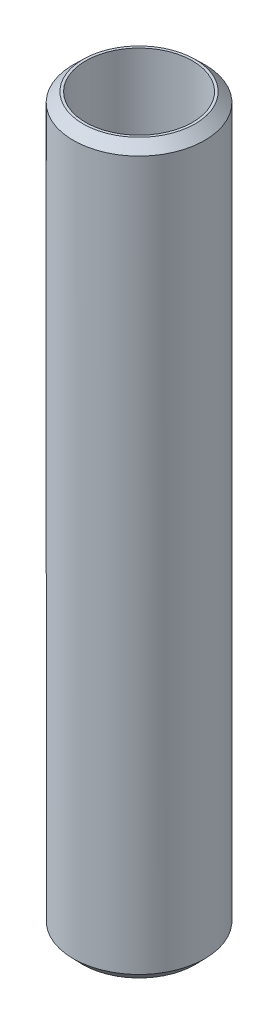
from build123d import *
from OCP.BRepFilletAPI import BRepFilletAPI_MakeChamfer

# Parameters (mm, degrees)
SKETCH1_R           = 32.5
BOSS_EXTRUDE1_DEPTH = 360.140918461
SKETCH2_R           = 26.420446691
CUT_EXTRUDE1_DEPTH  = 364.06195222
CHAMFER1_SIZE       = 4.666880794
CHAMFER1_SIZE2      = 4.810373558


with BuildPart() as part:
    # Sketch1 → Boss-Extrude1 (new body)
    with BuildSketch(Plane(origin=(0, 0, 0), x_dir=(1, 0, 0), z_dir=(0, 1, 0))):
        Circle(SKETCH1_R)
    extrude(amount=BOSS_EXTRUDE1_DEPTH)

    # Sketch2 → Cut-Extrude1 (cut, through all)
    with BuildSketch(Plane(origin=(0, 0, 0), x_dir=(1, 0, 0), z_dir=(0, 1, 0))):
        Circle(SKETCH2_R)
    extrude(amount=CUT_EXTRUDE1_DEPTH, mode=Mode.SUBTRACT)

    # Chamfer1: one chamfer whose edges measure the first distance from different faces: ONE call of the kernel's chamfer builder (chamfer() names one face for all edges)
    chamfer1_edges_1 = [part.edges().sort_by_distance(p)[0] for p in [
        (-32.5, 360.140918461, 0),
    ]]
    chamfer1_side_1 = [part.faces().sort_by_distance(p)[0] for p in [
        (-32.5, 180.070459231, 0),
    ]]
    chamfer1_edges_2 = [part.edges().sort_by_distance(p)[0] for p in [
        (-32.5, 0, 0),
    ]]
    chamfer1_side_2 = [part.faces().sort_by_distance(p)[0] for p in [
        (-31.580761184, 0, 0),
    ]]
    chamfer1 = BRepFilletAPI_MakeChamfer(part.part.solid().wrapped)
    for e in chamfer1_edges_1:
        chamfer1.Add(CHAMFER1_SIZE, CHAMFER1_SIZE2, e.wrapped, chamfer1_side_1[0].wrapped)  # the first distance lies on this face
    for e in chamfer1_edges_2:
        chamfer1.Add(CHAMFER1_SIZE, CHAMFER1_SIZE2, e.wrapped, chamfer1_side_2[0].wrapped)  # the first distance lies on this face
    add(Compound.cast(chamfer1.Shape()), mode=Mode.REPLACE)


solid = part.part
